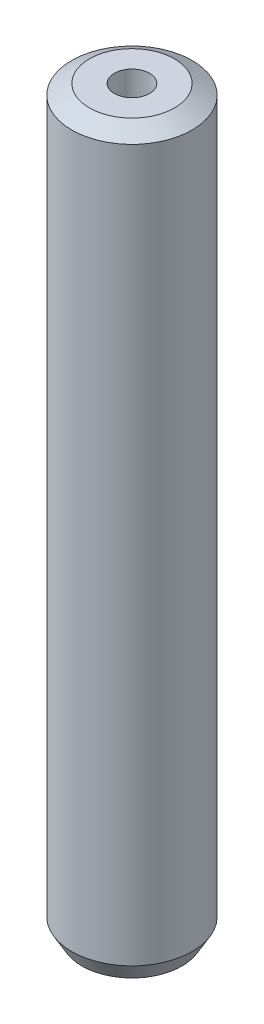
from build123d import *
from OCP.BRepFilletAPI import BRepFilletAPI_MakeChamfer

# Parameters (mm, degrees)
SKETCH1_R           = 27.5
BOSS_EXTRUDE1_DEPTH = 337.421841932
SKETCH2_R           = 8.027997665
CUT_EXTRUDE1_DEPTH  = 340.65570717
CHAMFER1_SIZE       = 4.668867069
CHAMFER1_SIZE2      = 8.086714978


with BuildPart() as part:
    # Sketch1 → Boss-Extrude1 (new body)
    with BuildSketch(Plane(origin=(0, 0, 0), x_dir=(1, 0, 0), z_dir=(0, 1, 0))):
        Circle(SKETCH1_R)
    extrude(amount=BOSS_EXTRUDE1_DEPTH)

    # Sketch2 → Cut-Extrude1 (cut, through all)
    with BuildSketch(Plane(origin=(0, 0, 0), x_dir=(1, 0, 0), z_dir=(0, 1, 0))):
        Circle(SKETCH2_R)
    extrude(amount=CUT_EXTRUDE1_DEPTH, mode=Mode.SUBTRACT)

    # Chamfer1: one chamfer whose edges measure the first distance from different faces: ONE call of the kernel's chamfer builder (chamfer() names one face for all edges)
    chamfer1_edges_1 = [part.edges().sort_by_distance(p)[0] for p in [
        (-27.5, 337.421841932, 0),
    ]]
    chamfer1_side_1 = [part.faces().sort_by_distance(p)[0] for p in [
        (-27.5, 168.710920966, 0),
    ]]
    chamfer1_edges_2 = [part.edges().sort_by_distance(p)[0] for p in [
        (-27.5, 0, 0),
    ]]
    chamfer1_side_2 = [part.faces().sort_by_distance(p)[0] for p in [
        (-26.722182541, 0, 0),
    ]]
    chamfer1 = BRepFilletAPI_MakeChamfer(part.part.solid().wrapped)
    for e in chamfer1_edges_1:
        chamfer1.Add(CHAMFER1_SIZE, CHAMFER1_SIZE2, e.wrapped, chamfer1_side_1[0].wrapped)  # the first distance lies on this face
    for e in chamfer1_edges_2:
        chamfer1.Add(CHAMFER1_SIZE, CHAMFER1_SIZE2, e.wrapped, chamfer1_side_2[0].wrapped)  # the first distance lies on this face
    add(Compound.cast(chamfer1.Shape()), mode=Mode.REPLACE)


solid = part.part
